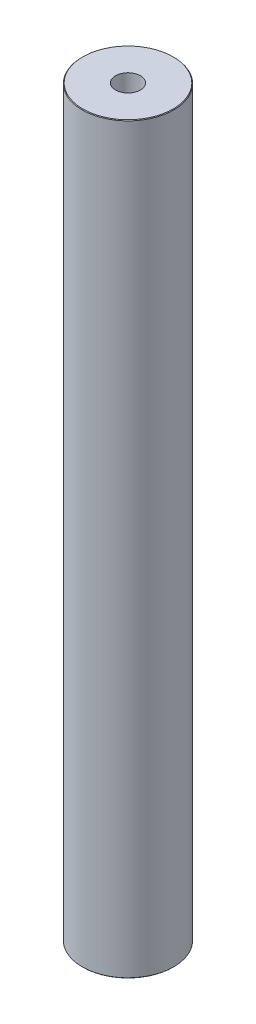
from build123d import *

# Parameters (mm, degrees)
SKETCH1_R           = 20
BOSS_EXTRUDE1_DEPTH = 324.92665828
SKETCH2_R           = 5.438155305
CUT_EXTRUDE1_DEPTH  = 327.155382082
CHAMFER1_SIZE       = 0.256155718


with BuildPart() as part:
    # Sketch1 → Boss-Extrude1 (new body)
    with BuildSketch(Plane(origin=(0, 0, 0), x_dir=(1, 0, 0), z_dir=(0, 1, 0))):
        Circle(SKETCH1_R)
    extrude(amount=BOSS_EXTRUDE1_DEPTH)

    # Sketch2 → Cut-Extrude1 (cut, through all)
    with BuildSketch(Plane(origin=(0, 0, 0), x_dir=(1, 0, 0), z_dir=(0, 1, 0))):
        Circle(SKETCH2_R)
    extrude(amount=CUT_EXTRUDE1_DEPTH, mode=Mode.SUBTRACT)

    # Chamfer1
    chamfer1_edges = [part.edges().sort_by_distance(p)[0] for p in [
        (-20, 324.92665828, 0),
        (-20, 0, 0),
    ]]
    chamfer(chamfer1_edges, length=CHAMFER1_SIZE)


solid = part.part
